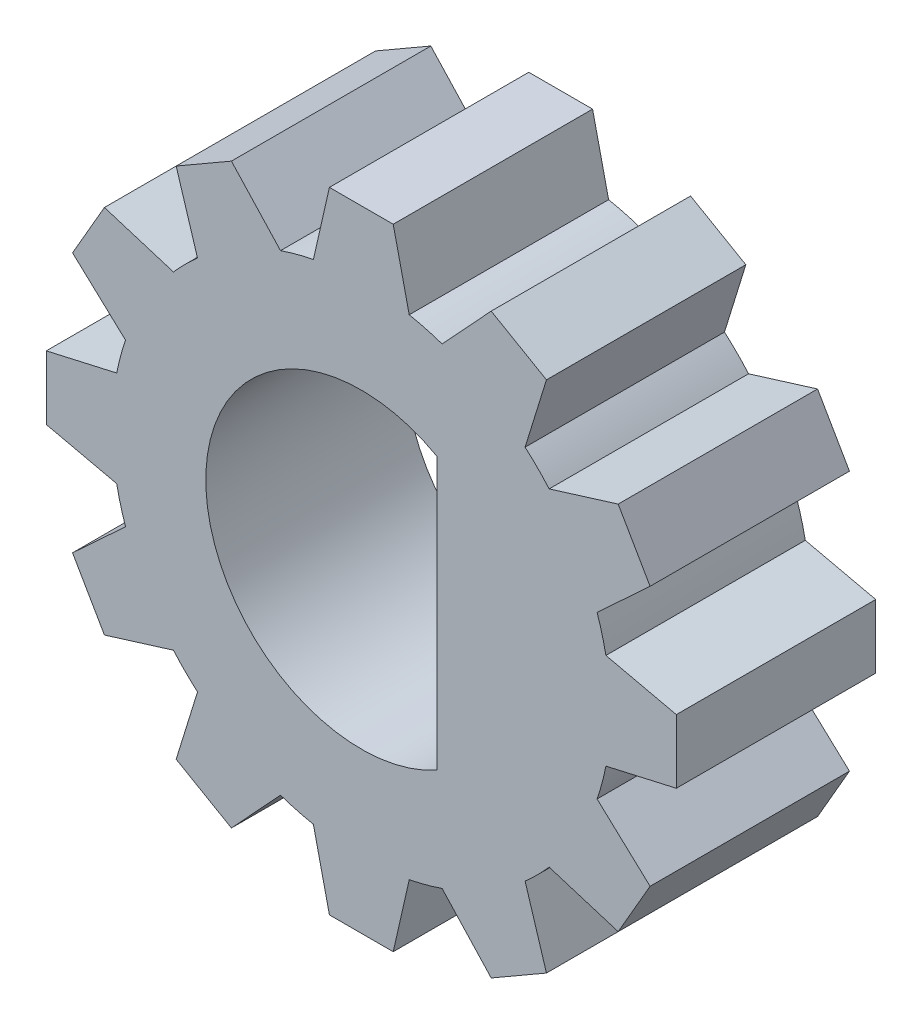
from build123d import *

# Parameters (mm, degrees)
SKETCH1_R           = 6.25
BOSS_EXTRUDE1_DEPTH = 5
BOSS_EXTRUDE2_DEPTH = 5
CIRPATTERN1_COUNT   = 12
CUT_EXTRUDE1_DEPTH  = 7


with BuildPart() as part:
    # Sketch1 → Boss-Extrude1 (new body)
    with BuildSketch(Plane.XY):
        Circle(SKETCH1_R)
    extrude(amount=BOSS_EXTRUDE1_DEPTH)

    # Sketch3 → Boss-Extrude2 (add)
    with BuildSketch(Plane.XY):
        Polygon((-0.8, 7.9), (0.8, 7.9), (1.3, 5.7), (-1.3, 5.7), align=None)
    boss_extrude2 = extrude(amount=BOSS_EXTRUDE2_DEPTH)

    # CirPattern1: Boss-Extrude2 ×12 about axis
    cirpattern1_axis = Axis((0, 0, 0), (0, 0, 1))
    for i in range(1, CIRPATTERN1_COUNT):
        add(boss_extrude2.rotate(cirpattern1_axis, i * 360 / CIRPATTERN1_COUNT))

    # Sketch4 → Cut-Extrude1 (cut)
    with BuildSketch(Plane.XY):
        with BuildLine():
            Line((1.9, 3.405877273), (1.9, -3.405877273))
            ThreePointArc((1.9, -3.405877273), (-3.9, 0), (1.9, 3.405877273))
        make_face()
    extrude(amount=CUT_EXTRUDE1_DEPTH, mode=Mode.SUBTRACT)


solid = part.part
